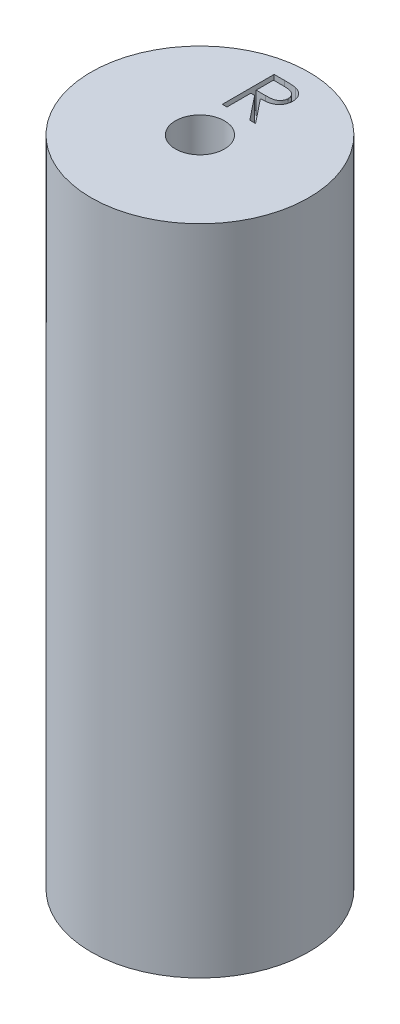
from build123d import *

# Parameters (mm, degrees)
SKETCH1_R           = 10
BOSS_EXTRUDE1_DEPTH = 4
SKETCH2_R           = 10
SKETCH2_R_2         = 8
SKETCH2_R_3         = 3.5
BOSS_EXTRUDE2_DEPTH = 52
SKETCH3_R           = 10
BOSS_EXTRUDE3_DEPTH = 4
CUT_EXTRUDE1_DEPTH  = 2
SKETCH5_R           = 2.25
CUT_EXTRUDE2_DEPTH  = 50


with BuildPart() as part:
    # Sketch1 → Boss-Extrude1 (new body)
    with BuildSketch(Plane(origin=(0, 0, 0), x_dir=(1, 0, 0), z_dir=(0, 1, 0))):
        Circle(SKETCH1_R)
    extrude(amount=BOSS_EXTRUDE1_DEPTH)

    # Sketch2 → Boss-Extrude2 (add)
    # profile 1 of 2: a face of its own
    with BuildSketch(Plane(origin=(0, 4, 0), x_dir=(1, 0, 0), z_dir=(0, 1, 0))):
        Circle(SKETCH2_R)
        Circle(SKETCH2_R_2, mode=Mode.SUBTRACT)
    # profile 2 of 2: a face of its own
    with BuildSketch(Plane(origin=(0, 4, 0), x_dir=(1, 0, 0), z_dir=(0, 1, 0))):
        Circle(SKETCH2_R_3)
    extrude(amount=BOSS_EXTRUDE2_DEPTH)

    # Sketch3 → Boss-Extrude3 (add)
    with BuildSketch(Plane(origin=(0, 56, 0), x_dir=(1, 0, 0), z_dir=(0, 1, 0))):
        Circle(SKETCH3_R)
    extrude(amount=BOSS_EXTRUDE3_DEPTH)

    # Sketch4 → Cut-Extrude1 (cut)
    with BuildSketch(Plane(origin=(0, 60, 0), x_dir=(1, 0, 0), z_dir=(0, 1, 0))):
        with BuildLine():
            Line((-1.404326923, 8.220249015), (-0.451254507, 8.220249015))
            add(Edge.make_bspline(
                [(-0.451254507, 8.220249015), (-0.387653186, 8.220037307), (-0.265531604, 8.219630804), (-0.090580118, 8.217364176), (0.068388182, 8.210867642), (0.211290178, 8.205277034), (0.338123247, 8.195082643), (0.449276311, 8.185339048), (0.544237428, 8.172584174), (0.601721961, 8.16073858), (0.627749399, 8.155375217)],
                knots=[0, 0, 0, 0, 1.410062039, 2.707475311, 3.878576406, 4.937260626, 5.877586885, 6.699081471, 7.410979367, 8, 8, 8, 8], degree=3))
            add(Edge.make_bspline(
                [(0.627749399, 8.155375217), (0.662592698, 8.146766297), (0.731535995, 8.129732108), (0.830800192, 8.093728152), (0.925389325, 8.052063591), (1.014910479, 8.003127243), (1.098915252, 7.946555846), (1.178269811, 7.883326008), (1.253334245, 7.813783703), (1.32107282, 7.73617558), (1.384943458, 7.654755186), (1.438812268, 7.56671186), (1.485248657, 7.474643853), (1.522219967, 7.377614831), (1.551989638, 7.276565777), (1.572980343, 7.170581378), (1.585568566, 7.06014448), (1.586850162, 6.984818183), (1.5875, 6.946623714)],
                knots=[0, 0, 0, 0, 1.027469482, 2.033020251, 3.019912614, 3.986113645, 4.951240523, 5.91722682, 6.890402269, 7.87763091, 8.8651537, 9.85103654, 10.82876324, 11.815024772, 12.821070561, 13.842952187, 14.906261191, 16, 16, 16, 16], degree=3))
            add(Edge.make_bspline(
                [(1.5875, 6.946623714), (1.585501113, 6.883166661), (1.581600768, 6.759345515), (1.545235537, 6.579648387), (1.485668201, 6.412022927), (1.40358544, 6.256680195), (1.299056082, 6.116648209), (1.17342842, 5.993652625), (1.02663237, 5.890728316), (0.889976765, 5.819355035), (0.769262086, 5.773644684), (0.669884614, 5.741482353), (0.56148062, 5.716633036), (0.445088747, 5.694371571), (0.32022463, 5.677564444), (0.187187541, 5.665254614), (0.045882599, 5.657561069), (-0.051189492, 5.656415341), (-0.101126803, 5.655825938)],
                knots=[0, 0, 0, 0, 1.260483769, 2.459530307, 3.627416485, 4.787058657, 5.939039949, 7.08810263, 8.267026773, 9.491475466, 10.141966685, 10.831826277, 11.566392101, 12.351337768, 13.187381173, 14.07005841, 15.007169909, 16, 16, 16, 16], degree=3))
            Line((-0.101126803, 5.655825938), (1.648557692, 3.457749015))
            Line((1.648557692, 3.457749015), (1.120027043, 3.457749015))
            Line((1.120027043, 3.457749015), (-0.629657452, 5.655825938))
            Line((-0.629657452, 5.655825938), (-0.976923077, 5.655825938))
            Line((-0.976923077, 5.655825938), (-0.976923077, 3.457749015))
            Line((-0.976923077, 3.457749015), (-1.404326923, 3.457749015))
            Line((-1.404326923, 3.457749015), (-1.404326923, 8.220249015))
        make_face()
        with BuildLine():
            Line((-0.976923077, 7.731787476), (-0.976923077, 6.144287476))
            Line((-0.976923077, 6.144287476), (-0.104942909, 6.137609291))
            add(Edge.make_bspline(
                [(-0.104942909, 6.137609291), (-0.064230284, 6.13759128), (0.014682377, 6.137556369), (0.128847211, 6.142990757), (0.235146363, 6.149172915), (0.333173243, 6.158628989), (0.422971644, 6.170815644), (0.504496681, 6.186059705), (0.577881434, 6.203819833), (0.663468374, 6.231308474), (0.759040225, 6.27485952), (0.862905533, 6.338221859), (0.951355143, 6.417917696), (1.026082663, 6.509049435), (1.08613021, 6.60924733), (1.128464827, 6.717310318), (1.15532865, 6.830510314), (1.158497136, 6.908313383), (1.160096154, 6.947577741)],
                knots=[0, 0, 0, 0, 1.146690395, 2.22261258, 3.21895312, 4.145990853, 4.996080663, 5.770904154, 6.481378293, 7.121626537, 8.300444488, 9.431385265, 10.535395872, 11.636531494, 12.74115979, 13.810798291, 14.895190096, 16, 16, 16, 16], degree=3))
            add(Edge.make_bspline(
                [(1.160096154, 6.947577741), (1.158460411, 6.985877186), (1.155218964, 7.061772711), (1.128754747, 7.172883074), (1.084001696, 7.277749174), (1.023691794, 7.37594442), (0.950214372, 7.46507901), (0.86405692, 7.541343172), (0.767575208, 7.60427548), (0.677399041, 7.644490547), (0.596798202, 7.66914649), (0.526817129, 7.686497181), (0.447744011, 7.700436976), (0.359194905, 7.711605802), (0.261547829, 7.721205566), (0.15430905, 7.727671379), (0.038190074, 7.731500244), (-0.042292, 7.731689504), (-0.083954327, 7.731787476)],
                knots=[0, 0, 0, 0, 1.101028733, 2.181837193, 3.264309656, 4.369019818, 5.486613113, 6.575447106, 7.666700264, 8.788928104, 9.402425223, 10.0903467, 10.862060571, 11.710948788, 12.657782767, 13.684531032, 14.801375019, 16, 16, 16, 16], degree=3))
            Line((-0.083954327, 7.731787476), (-0.976923077, 7.731787476))
        make_face(mode=Mode.SUBTRACT)
    extrude(amount=-CUT_EXTRUDE1_DEPTH, mode=Mode.SUBTRACT)

    # Sketch5 → Cut-Extrude2 (cut)
    with BuildSketch(Plane(origin=(0, 60, 0), x_dir=(1, 0, 0), z_dir=(0, 1, 0))):
        Circle(SKETCH5_R)
    extrude(amount=-CUT_EXTRUDE2_DEPTH, mode=Mode.SUBTRACT)


solid = part.part
